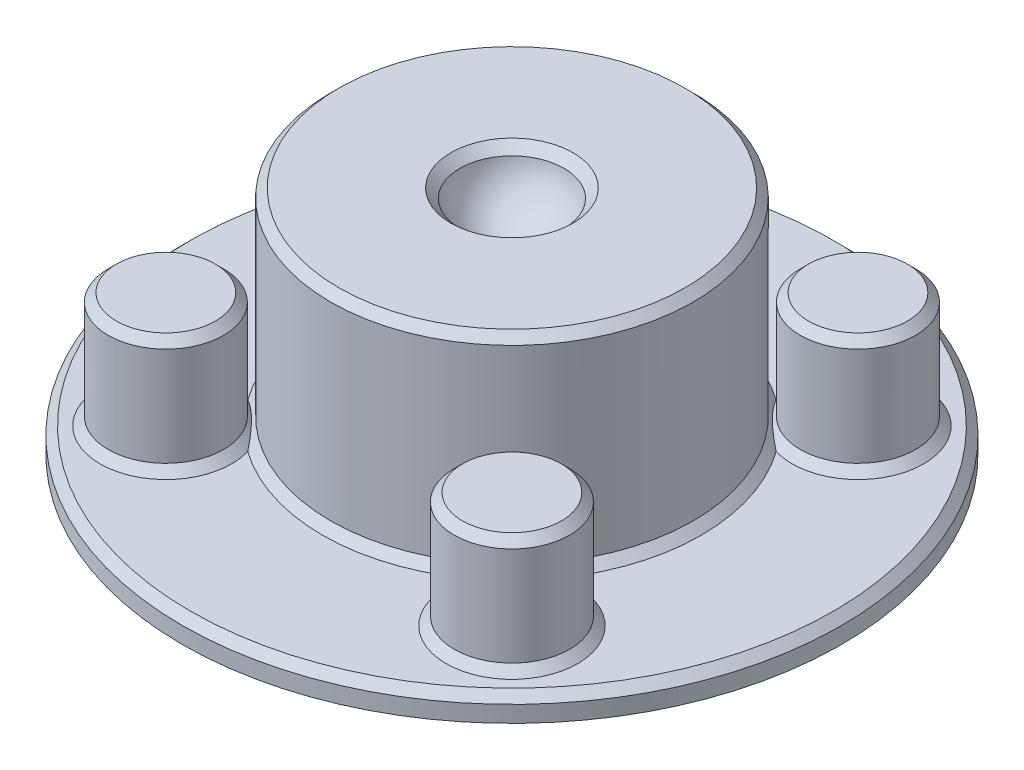
from build123d import *

# Parameters (mm, degrees)
SKETCH1_R                 = 40
HOLDER_BASE_DEPTH         = 3
SKETCH2_R                 = 22
BALL_HOLDER_EXTRUDE_DEPTH = 25
SKETCH3_R                 = 7
PEG_EXTRUDES_DEPTH        = 14
SKETCH4_R                 = 5.25
PEG_HOLES_DEPTH           = 14
CHAMFER1_SIZE             = 1
CHAMFER2_SIZE             = 1


with BuildPart() as part:
    # Sketch1 → Holder Base (new body)
    with BuildSketch(Plane(origin=(0, 0, 0), x_dir=(1, 0, 0), z_dir=(0, 1, 0))):
        with Locations(Location((0, 0, 0), (0, 0, 270))):
            Circle(SKETCH1_R)
    extrude(amount=HOLDER_BASE_DEPTH)

    # Sketch2 → Ball Holder Extrude (add)
    with BuildSketch(Plane(origin=(0, 3, 0), x_dir=(1, 0, 0), z_dir=(0, 1, 0))):
        with Locations(Location((0, 0, 0), (0, 0, 270))):
            Circle(SKETCH2_R)
    extrude(amount=BALL_HOLDER_EXTRUDE_DEPTH)

    # Sketch5 → Ball Cut (revolve, cut)
    with BuildSketch(Plane.XY):
        with BuildLine():
            Line((0, 21.5865), (0, 34.4135))
            ThreePointArc((0, 34.4135), (-6.4135, 28), (0, 21.5865))
        make_face()
    revolve(axis=Axis((0, -1000, 0), (0, 1, 0)), mode=Mode.SUBTRACT)

    # Sketch3 → Peg Extrudes (add)
    with BuildSketch(Plane(origin=(0, 3, 0), x_dir=(1, 0, 0), z_dir=(0, 1, 0))):
        with Locations(Location((-21, 21, 0), (0, 0, 270))):
            Circle(SKETCH3_R)
        with Locations(Location((21, 21, 0), (0, 0, 270))):
            Circle(SKETCH3_R)
        with Locations(Location((21, -21, 0), (0, 0, 270))):
            Circle(SKETCH3_R)
        with Locations(Location((-21, -21, 0), (0, 0, 270))):
            Circle(SKETCH3_R)
    extrude(amount=PEG_EXTRUDES_DEPTH)

    # Sketch4 → Peg Holes (cut)
    with BuildSketch(Plane.XZ):
        with Locations(Location((-21, -21, 0), (0, 0, 270))):
            Circle(SKETCH4_R)
        with Locations(Location((-21, 21, 0), (0, 0, 270))):
            Circle(SKETCH4_R)
        with Locations(Location((21, 21, 0), (0, 0, 270))):
            Circle(SKETCH4_R)
        with Locations(Location((21, -21, 0), (0, 0, 270))):
            Circle(SKETCH4_R)
    extrude(amount=-PEG_HOLES_DEPTH, mode=Mode.SUBTRACT)

    # Chamfer1
    # the kernel refuses this chamfer: 1 mm, written as the material it adds along each edge
    with BuildSketch(Plane(origin=(-21, 3, -21), x_dir=(0, 0, 1), z_dir=(-1, 0, 0))) as chamfer1_piece_1:
        Polygon((7 + CHAMFER1_SIZE, 0), (7, CHAMFER1_SIZE), (7, 0), align=None)
    revolve(axis=Axis((-21, 3, -21), (0, 1, 0)))
    with BuildSketch(Plane(origin=(21, 3, -21), x_dir=(0, 0, 1), z_dir=(-1, 0, 0))) as chamfer1_piece_2:
        Polygon((7 + CHAMFER1_SIZE, 0), (7, CHAMFER1_SIZE), (7, 0), align=None)
    revolve(axis=Axis((21, 3, -21), (0, 1, 0)))
    with BuildSketch(Plane(origin=(21, 3, 21), x_dir=(0, 0, 1), z_dir=(-1, 0, 0))) as chamfer1_piece_3:
        Polygon((7 + CHAMFER1_SIZE, 0), (7, CHAMFER1_SIZE), (7, 0), align=None)
    revolve(axis=Axis((21, 3, 21), (0, 1, 0)))
    with BuildSketch(Plane(origin=(-21, 3, 21), x_dir=(0, 0, 1), z_dir=(-1, 0, 0))) as chamfer1_piece_4:
        Polygon((7 + CHAMFER1_SIZE, 0), (7, CHAMFER1_SIZE), (7, 0), align=None)
    revolve(axis=Axis((-21, 3, 21), (0, 1, 0)))
    with BuildSketch(Plane(origin=(0, 3, 0), x_dir=(0, 0, 1), z_dir=(-1, 0, 0))) as chamfer1_piece_5:
        Polygon((22 + CHAMFER1_SIZE, 0), (22, CHAMFER1_SIZE), (22, 0), align=None)
    revolve(axis=Axis((0, 3, 0), (0, 1, 0)))
    # the kernel refuses this chamfer: 1 mm, written as the material it takes off along each edge
    with BuildSketch(Plane(origin=(0, 28, 0), x_dir=(-1, 0, 0), z_dir=(0, 0, 1))) as chamfer1_2_piece_1:
        with BuildLine():
            Line((6.4135 + CHAMFER1_SIZE, 0), (6.319506315, 1.093993685))
            ThreePointArc((6.319506315, 1.093993685), (6.388622712, 0.564342173), (6.4135, 0))
            Line((6.4135, 0), (6.4135 + CHAMFER1_SIZE, 0))
        make_face()
    revolve(axis=Axis((0, 28, 0), (0, -1, 0)), mode=Mode.SUBTRACT)
    with BuildSketch(Plane(origin=(-21, 17, -21), x_dir=(0, 0, 1), z_dir=(-1, 0, 0))) as chamfer1_2_piece_2:
        Polygon((7, -CHAMFER1_SIZE), (7 - CHAMFER1_SIZE, 0), (7, 0), align=None)
    revolve(axis=Axis((-21, 17, -21), (0, 1, 0)), mode=Mode.SUBTRACT)
    with BuildSketch(Plane(origin=(21, 17, -21), x_dir=(0, 0, 1), z_dir=(-1, 0, 0))) as chamfer1_2_piece_3:
        Polygon((7, -CHAMFER1_SIZE), (7 - CHAMFER1_SIZE, 0), (7, 0), align=None)
    revolve(axis=Axis((21, 17, -21), (0, 1, 0)), mode=Mode.SUBTRACT)
    with BuildSketch(Plane(origin=(21, 17, 21), x_dir=(0, 0, 1), z_dir=(-1, 0, 0))) as chamfer1_2_piece_4:
        Polygon((7, -CHAMFER1_SIZE), (7 - CHAMFER1_SIZE, 0), (7, 0), align=None)
    revolve(axis=Axis((21, 17, 21), (0, 1, 0)), mode=Mode.SUBTRACT)
    with BuildSketch(Plane(origin=(-21, 17, 21), x_dir=(0, 0, 1), z_dir=(-1, 0, 0))) as chamfer1_2_piece_5:
        Polygon((7, -CHAMFER1_SIZE), (7 - CHAMFER1_SIZE, 0), (7, 0), align=None)
    revolve(axis=Axis((-21, 17, 21), (0, 1, 0)), mode=Mode.SUBTRACT)
    with BuildSketch(Plane(origin=(0, 3, 0), x_dir=(0, 0, 1), z_dir=(-1, 0, 0))) as chamfer1_2_piece_6:
        Polygon((40, -CHAMFER1_SIZE), (40 - CHAMFER1_SIZE, 0), (40, 0), align=None)
    revolve(axis=Axis((0, 3, 0), (0, 1, 0)), mode=Mode.SUBTRACT)
    with BuildSketch(Plane(origin=(0, 28, 0), x_dir=(0, 0, 1), z_dir=(-1, 0, 0))) as chamfer1_2_piece_7:
        Polygon((22, -CHAMFER1_SIZE), (22 - CHAMFER1_SIZE, 0), (22, 0), align=None)
    revolve(axis=Axis((0, 28, 0), (0, 1, 0)), mode=Mode.SUBTRACT)

    # Chamfer2
    chamfer2_edges = [part.edges().sort_by_distance(p)[0] for p in [
        (21, 14, -15.75),
        (21, 0, -15.75),
        (21, 14, 26.25),
        (21, 0, 26.25),
        (-21, 14, 26.25),
        (-21, 0, 26.25),
        (-21, 14, -15.75),
        (-21, 0, -15.75),
    ]]
    chamfer(chamfer2_edges, length=CHAMFER2_SIZE)


solid = part.part
